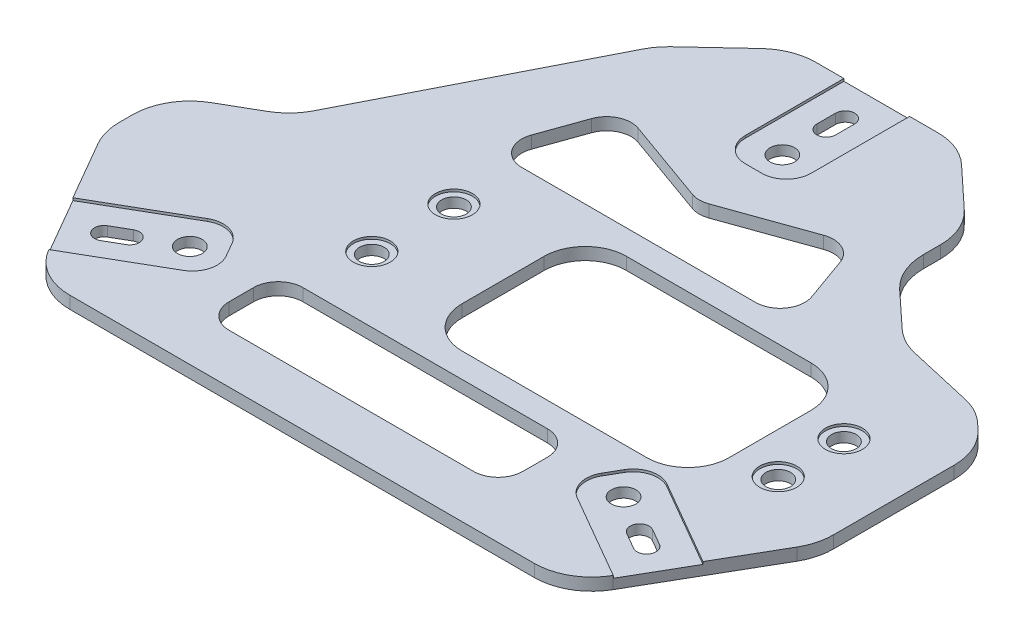
from build123d import *

# Parameters (mm, degrees)
BOSS_EXTRUDE1_DEPTH                     = 0.75
BOSS_EXTRUDE1_DEPTH_BACK                = 0.75
FILLET_7MM_R                            = 7
FILLET_8MM_R                            = 7
GROOVES_START                           = -0.3
GROOVES_DEPTH                           = 61.785535461
SKETCH6_R                               = 1.5
COPPERROD_HOLES_DEPTH                   = 61.478839275
CIRPATTERN1_COUNT                       = 3
SKETCH9_W                               = 32.5
SKETCH9_H                               = 20
SKETCH9_W_2                             = 35.79
SKETCH9_H_2                             = 9
CUT_EXTRUDE3_DEPTH                      = 61.485535461
FILLET_5MM_R                            = 5
FILLET_3MM_R                            = 3
CBORE_FOR_M5_HEX_HEAD_BOLT1_D           = 3
CBORE_FOR_M5_HEX_HEAD_BOLT1_CBORE_D     = 4.5
CBORE_FOR_M5_HEX_HEAD_BOLT1_CBORE_DEPTH = 0.3


with BuildPart() as part:
    # Sketch5 → Boss-Extrude1 (new, two sides: drawn at the far end of the back side and taken through both)
    with BuildSketch(Plane(origin=(0, 0, 0), x_dir=(1, 0, 0), z_dir=(0, 1, 0)).offset(-BOSS_EXTRUDE1_DEPTH_BACK)):
        Polygon((-32.33, -28), (32.33, -28), (43.5, -8.652992479), (43.5, 10.937007521), (39.109866167, 15.114366127), (27.41180038, 17.789297314), (19.417173714, 25.213180696), (19.417173714, 33.393180696), (10.18749, 42), (-10.18749, 42), (-18.785888774, 33.9772113), (-33.80897843, 4.471637637), (-43.5, -1.102992479), (-43.5, -8.652992479), align=None)
    extrude(amount=BOSS_EXTRUDE1_DEPTH + BOSS_EXTRUDE1_DEPTH_BACK)

    # Fillet_7mm
    fillet_7mm_edges = [part.edges().sort_by_distance(p)[0] for p in [
        (10.18749, 0, -42),
        (43.5, 0, -10.937007521),
        (43.5, 0, 8.652992479),
        (32.33, 0, 28),
        (-32.33, 0, 28),
        (-43.5, 0, 8.652992479),
        (-10.18749, 0, -42),
    ]]
    fillet(fillet_7mm_edges, radius=FILLET_7MM_R)

    # Fillet_8mm
    fillet_8mm_edges = [part.edges().sort_by_distance(p)[0] for p in [
        (19.417173714, 0, -33.393180696),
        (19.417173714, 0, -25.213180696),
        (27.41180038, 0, -17.789297314),
        (39.109866167, 0, -15.114366127),
        (-43.5, 0, 1.102992479),
        (-33.80897843, 0, -4.471637637),
        (-18.785888774, 0, -33.9772113),
    ]]
    fillet(fillet_8mm_edges, radius=FILLET_8MM_R)

    # Sketch7 → Grooves (cut)
    with BuildSketch(Plane(origin=(0, 0.75, 0), x_dir=(1, 0, 0), z_dir=(0, 1, 0)).offset(GROOVES_START)):
        with BuildLine():
            Line((-0.999540438, 27.000000006), (1.000376004, 27.000000006))
            ThreePointArc((1.000376004, 27.000000006), (3.121696347, 27.878679662), (4.000376004, 30.000000006))
            Line((4.000376004, 30.000000006), (4.000376004, 42))
            Line((4.000376004, 42), (-3.999206213, 42))
            Line((-3.999206213, 42), (-3.999540437, 30.000083562))
            ThreePointArc((-3.999540437, 30.000083562), (-3.120890324, 27.878709204), (-0.999540438, 27.000000006))
        make_face()
    grooves = extrude(amount=GROOVES_DEPTH, mode=Mode.SUBTRACT)

    # Sketch6 → CopperRod_Holes (cut, through all)
    with BuildSketch(Plane(origin=(0, 0.45, 0), x_dir=(1, 0, 0), z_dir=(0, 1, 0))):
        with Locations((0, 30.5)):
            Circle(SKETCH6_R)
        with BuildLine():
            ThreePointArc((-1.15, 35.85), (0, 34.7), (1.15, 35.85))
            Line((1.15, 35.85), (1.15, 38.15))
            ThreePointArc((1.15, 38.15), (0, 39.3), (-1.15, 38.15))
            Line((-1.15, 38.15), (-1.15, 35.85))
        make_face()
    copperrod_holes = extrude(amount=-COPPERROD_HOLES_DEPTH, mode=Mode.SUBTRACT)

    # CirPattern1: Grooves, CopperRod_Holes ×3 about axis
    cirpattern1_axis = Axis((0, 0.825, 0), (0, -1, 0))
    add([grooves.rotate(cirpattern1_axis, i * 360 / CIRPATTERN1_COUNT) for i in range(1, CIRPATTERN1_COUNT)], mode=Mode.SUBTRACT)
    add([copperrod_holes.rotate(cirpattern1_axis, i * 360 / CIRPATTERN1_COUNT) for i in range(1, CIRPATTERN1_COUNT)], mode=Mode.SUBTRACT)

    # Sketch9 → Cut-Extrude3 (cut, through all)
    with BuildSketch(Plane(origin=(0, 0.75, 0), x_dir=(1, 0, 0), z_dir=(0, 1, 0))):
        with Locations((12.75, 0)):
            Rectangle(SKETCH9_W, SKETCH9_H)
        with Locations((0, -17.5)):
            Rectangle(SKETCH9_W_2, SKETCH9_H_2)
        Polygon((-18.5, 13), (18.5, 13), (14.125077971, 25.241734242), (0, 20.193747285), (-14.125077971, 25.241734242), align=None)
    extrude(amount=-CUT_EXTRUDE3_DEPTH, mode=Mode.SUBTRACT)

    # Fillet_5mm
    fillet_5mm_edges = [part.edges().sort_by_distance(p)[0] for p in [
        (29, 0, 10),
        (-3.5, 0, 10),
        (-3.5, 0, -10),
        (29, 0, -10),
    ]]
    fillet(fillet_5mm_edges, radius=FILLET_5MM_R)

    # Fillet_3mm
    fillet_3mm_edges = [part.edges().sort_by_distance(p)[0] for p in [
        (17.895, 0, 22),
        (-17.895, 0, 22),
        (-17.895, 0, 13),
        (17.895, 0, 13),
        (18.5, 0, -13),
        (-18.5, 0, -13),
        (-14.125077971, 0, -25.241734242),
        (0, 0, -20.193747285),
        (14.125077971, 0, -25.241734242),
    ]]
    fillet(fillet_3mm_edges, radius=FILLET_3MM_R)

    # CBORE for M5 Hex Head Bolt1 (through all)
    with Locations(Plane(origin=(-14.5, 0.75, -5), x_dir=(0, 0, 1), z_dir=(0, 1, 0))):
        with Locations((0, 0), (10, 0), (1, 48.5), (9, 48.5)):
            CounterBoreHole(CBORE_FOR_M5_HEX_HEAD_BOLT1_D / 2, CBORE_FOR_M5_HEX_HEAD_BOLT1_CBORE_D / 2, CBORE_FOR_M5_HEX_HEAD_BOLT1_CBORE_DEPTH)


solid = part.part
